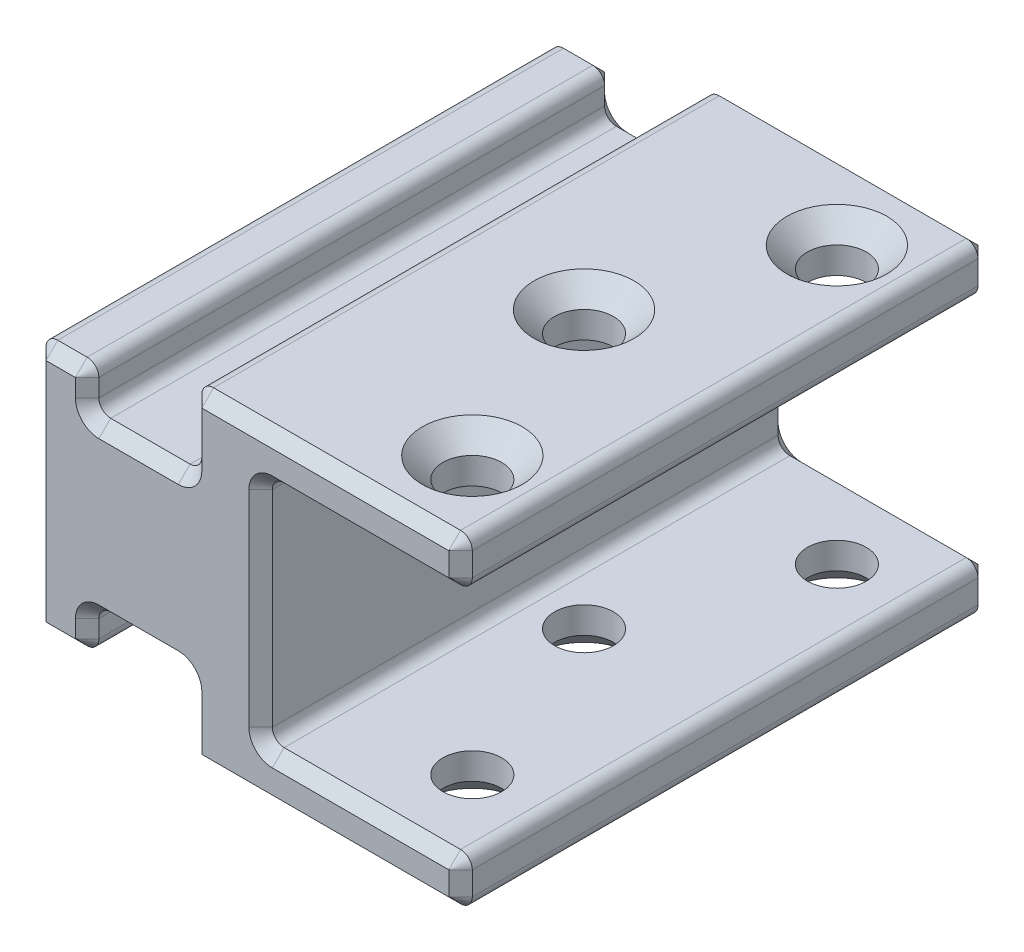
from build123d import *

# Parameters (mm, degrees)
BOSS_EXTRUDE1_DEPTH = 22.5
SKETCH2_R           = 2.5
CUT_EXTRUDE1_DEPTH  = 51.759851261
CHAMFER1_SIZE       = 1.75
FILLET1_R           = 1
CHAMFER2_SIZE       = 1


with BuildPart() as part:
    # Sketch1 → Boss-Extrude1 (new, symmetric)
    with BuildSketch(Plane.XY):
        Polygon((0, -10.625), (0, 10.625), (4.5, 10.625), (4.5, 7.125), (13.25, 7.125), (13.25, 13.75), (36.25, 13.75), (36.25, 9.75), (19.25, 9.75), (19.25, -9.75), (36.25, -9.75), (36.25, -13.75), (13.25, -13.75), (13.25, -7.125), (4.5, -7.125), (4.5, -10.625), align=None)
    extrude(amount=BOSS_EXTRUDE1_DEPTH, both=True)

    # Sketch2 → Cut-Extrude1 (cut, through all)
    with BuildSketch(Plane.XZ.offset(13.75)):
        with Locations((30.25, 15.5)):
            Circle(SKETCH2_R)
        with Locations((24.25, 0)):
            Circle(SKETCH2_R)
        with Locations((30.25, -15.5)):
            Circle(SKETCH2_R)
    extrude(amount=-CUT_EXTRUDE1_DEPTH, mode=Mode.SUBTRACT)

    # Chamfer1
    chamfer1_edges = [part.edges().sort_by_distance(p)[0] for p in [
        (27.75, 13.75, -15.5),
        (21.75, 13.75, 0),
        (27.75, 13.75, 15.5),
        (27.75, -13.75, -15.5),
        (27.75, -13.75, 15.5),
        (21.75, -13.75, 0),
    ]]
    chamfer(chamfer1_edges, length=CHAMFER1_SIZE)

    # Fillet1
    fillet1_edges = [part.edges().sort_by_distance(p)[0] for p in [
        (4.5, 10.625, 0),
        (4.5, 7.125, 0),
        (13.25, 7.125, 0),
        (13.25, 13.75, 0),
        (36.25, 13.75, 0),
        (36.25, 9.75, 0),
        (19.25, 9.75, 0),
        (19.25, -9.75, 0),
        (36.25, -9.75, 0),
        (36.25, -13.75, 0),
        (13.25, -13.75, 0),
        (13.25, -7.125, 0),
        (4.5, -7.125, 0),
        (0, -10.625, 0),
        (0, 10.625, 0),
        (4.5, -10.625, 0),
    ]]
    fillet(fillet1_edges, radius=FILLET1_R)

    # Chamfer2
    chamfer2_edges = [part.edges().sort_by_distance(p)[0] for p in [
        (24.75, 13.75, -22.5),
        (13.542893219, 13.457106781, -22.5),
        (35.957106781, 13.457106781, -22.5),
        (13.25, 10.4375, -22.5),
        (36.25, 11.75, -22.5),
        (12.957106781, 7.417893219, -22.5),
        (35.957106781, 10.042893219, -22.5),
        (8.875, 7.125, -22.5),
        (27.75, 9.75, -22.5),
        (4.792893219, 7.417893219, -22.5),
        (19.542893219, 9.457106781, -22.5),
        (4.5, 8.875, -22.5),
        (19.25, 0, -22.5),
        (4.207106781, 10.332106781, -22.5),
        (19.542893219, -9.457106781, -22.5),
        (2.25, 10.625, -22.5),
        (27.75, -9.75, -22.5),
        (0.292893219, 10.332106781, -22.5),
        (35.957106781, -10.042893219, -22.5),
        (0, 0, -22.5),
        (36.25, -11.75, -22.5),
        (0.292893219, -10.332106781, -22.5),
        (35.957106781, -13.457106781, -22.5),
        (2.25, -10.625, -22.5),
        (24.75, -13.75, -22.5),
        (4.207106781, -10.332106781, -22.5),
        (13.542893219, -13.457106781, -22.5),
        (4.5, -8.875, -22.5),
        (13.25, -10.4375, -22.5),
        (4.792893219, -7.417893219, -22.5),
        (12.957106781, -7.417893219, -22.5),
        (8.875, -7.125, -22.5),
        (24.75, 13.75, 22.5),
        (13.542893219, 13.457106781, 22.5),
        (35.957106781, 13.457106781, 22.5),
        (13.25, 10.4375, 22.5),
        (36.25, 11.75, 22.5),
        (12.957106781, 7.417893219, 22.5),
        (35.957106781, 10.042893219, 22.5),
        (8.875, 7.125, 22.5),
        (27.75, 9.75, 22.5),
        (4.792893219, 7.417893219, 22.5),
        (19.542893219, 9.457106781, 22.5),
        (4.5, 8.875, 22.5),
        (19.25, 0, 22.5),
        (4.207106781, 10.332106781, 22.5),
        (19.542893219, -9.457106781, 22.5),
        (2.25, 10.625, 22.5),
        (27.75, -9.75, 22.5),
        (0.292893219, 10.332106781, 22.5),
        (35.957106781, -10.042893219, 22.5),
        (0, 0, 22.5),
        (36.25, -11.75, 22.5),
        (0.292893219, -10.332106781, 22.5),
        (35.957106781, -13.457106781, 22.5),
        (2.25, -10.625, 22.5),
        (24.75, -13.75, 22.5),
        (4.207106781, -10.332106781, 22.5),
        (13.542893219, -13.457106781, 22.5),
        (4.5, -8.875, 22.5),
        (13.25, -10.4375, 22.5),
        (4.792893219, -7.417893219, 22.5),
        (12.957106781, -7.417893219, 22.5),
        (8.875, -7.125, 22.5),
    ]]
    chamfer(chamfer2_edges, length=CHAMFER2_SIZE)


solid = part.part
